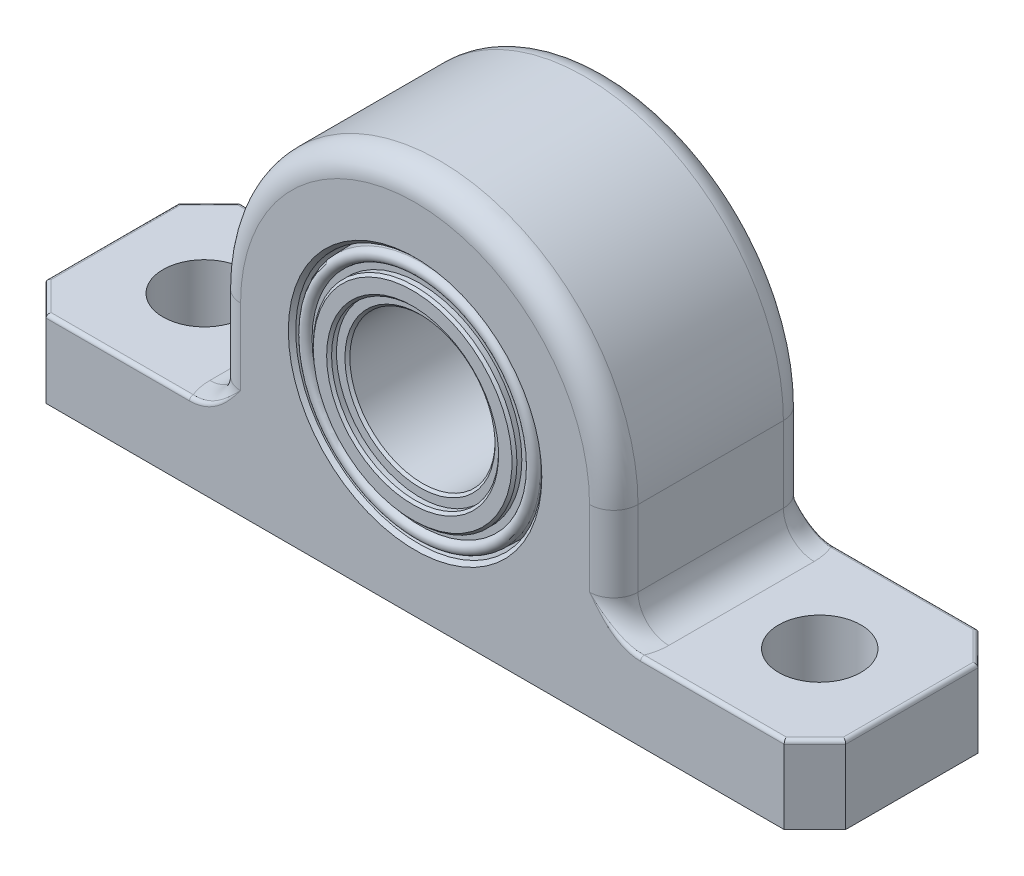
from build123d import *

# Parameters (mm, degrees)
BOSS_EXTRUDE1_DEPTH      = 10
BOSS_EXTRUDE1_DEPTH_BACK = 10
SKETCH3_R                = 12.6952
SKETCH4_R                = 4.25
CUT_EXTRUDE1_DEPTH       = 58.981139175
CHAMFER1_SIZE            = 3.175
FILLET1_R                = 2.5
FILLET2_R                = 3.175
CHAMFER2_SIZE            = 0.381
FILLET3_R                = 0.381
CHAMFER3_SIZE            = 0.254


with BuildPart() as part:
    # Sketch3 → Boss-Extrude1 (new, two sides: drawn at the far end of the back side and taken through both)
    with BuildSketch(Plane.XY.offset(-BOSS_EXTRUDE1_DEPTH_BACK)):
        with BuildLine():
            Line((-41.25, 0), (-41.25, 8))
            Line((-41.25, 8), (-20.5, 8))
            Line((-20.5, 8), (-20.5, 19))
            ThreePointArc((-20.5, 19), (0, 39.5), (20.5, 19))
            Line((20.5, 19), (20.5, 8))
            Line((20.5, 8), (41.25, 8))
            Line((41.25, 8), (41.25, 0))
            Line((41.25, 0), (-41.25, 0))
        make_face()
        with Locations((0, 19)):
            Circle(SKETCH3_R, mode=Mode.SUBTRACT)
    extrude(amount=BOSS_EXTRUDE1_DEPTH + BOSS_EXTRUDE1_DEPTH_BACK)

    # Sketch4 → Cut-Extrude1 (cut, through all)
    with BuildSketch(Plane(origin=(0, 0, 0), x_dir=(1, 0, 0), z_dir=(0, 1, 0))):
        with Locations(Location((-31.75, 0, 0), (0, 0, 270))):
            Circle(SKETCH4_R)
        with Locations(Location((31.75, 0, 0), (0, 0, 180))):
            Circle(SKETCH4_R)
    extrude(amount=CUT_EXTRUDE1_DEPTH, mode=Mode.SUBTRACT)

    # Chamfer1
    chamfer1_edges = [part.edges().sort_by_distance(p)[0] for p in [
        (41.25, 4, 10),
        (-41.25, 4, -10),
        (-41.25, 4, 10),
        (41.25, 4, -10),
    ]]
    chamfer(chamfer1_edges, length=CHAMFER1_SIZE)

    # Fillet1
    fillet1_edges = [part.edges().sort_by_distance(p)[0] for p in [
        (20.5, 13.5, -10),
        (0, 39.5, -10),
        (-20.5, 13.5, -10),
        (20.5, 13.5, 10),
        (0, 39.5, 10),
        (-20.5, 13.5, 10),
    ]]
    fillet(fillet1_edges, radius=FILLET1_R)

    # Fillet2
    # the kernel refuses this fillet: 3.175 mm, written as the material it adds along each edge
    with BuildSketch(Plane(origin=(-20.5, 8, 7.5), x_dir=(-1, 0, 0), z_dir=(0, 0, -1))) as fillet2_piece_1:
        with BuildLine():
            CenterArc((FILLET2_R, FILLET2_R), FILLET2_R, 180, 90)
            Line((0, FILLET2_R), (0, 0))
            Line((0, 0), (FILLET2_R, 0))
        make_face()
    extrude(amount=15)
    with BuildSketch(Plane(origin=(20.5, 8, 7.5), x_dir=(1, 0, 0), z_dir=(0, 0, -1))) as fillet2_piece_2:
        with BuildLine():
            CenterArc((FILLET2_R, -FILLET2_R), FILLET2_R, 90, 90)
            Line((0, -FILLET2_R), (0, 0))
            Line((0, 0), (FILLET2_R, 0))
        make_face()
    extrude(amount=15)
    with BuildSketch(Plane(origin=(-18, 8, -7.5), x_dir=(-0.03467581693539278, 0, 0.9993986130267857), z_dir=(-0.9993986130267857, 0, -0.03467581693539278))) as fillet2_piece_3_section:
        with BuildLine():
            CenterArc((-2.5 - FILLET2_R, FILLET2_R), FILLET2_R, 270, 90)
            Line((-2.5, FILLET2_R), (-2.5, 0))
            Line((-2.5, 0), (-2.5 - FILLET2_R, 0))
        make_face()
    fillet2_piece_3 = revolve(axis=Axis((-18, 8, -7.5), (0, 1, 0)), revolution_arc=271.987176332, mode=Mode.PRIVATE)
    fillet2_piece_3 = split(fillet2_piece_3, bisect_by=Plane(origin=(-19.885490697, 9.038383222, -10), z_dir=(0, 0, 1)), keep=Keep.TOP, mode=Mode.PRIVATE)
    add(fillet2_piece_3)
    with BuildSketch(Plane(origin=(-18, 8, 7.5), x_dir=(-0.03467581693539278, 0, -0.9993986130267857), z_dir=(-0.9993986130267857, 0, 0.03467581693539278))) as fillet2_piece_4_section:
        with BuildLine():
            CenterArc((-2.5 - FILLET2_R, -FILLET2_R), FILLET2_R, 0, 90)
            Line((-2.5, -FILLET2_R), (-2.5, 0))
            Line((-2.5, 0), (-2.5 - FILLET2_R, 0))
        make_face()
    fillet2_piece_4 = revolve(axis=Axis((-18, 8, 7.5), (0, -1, 0)), revolution_arc=271.987176332, mode=Mode.PRIVATE)
    fillet2_piece_4 = split(fillet2_piece_4, bisect_by=Plane(origin=(-19.885490697, 9.038383222, 10), z_dir=(0, 0, -1)), keep=Keep.TOP, mode=Mode.PRIVATE)
    add(fillet2_piece_4)
    with BuildSketch(Plane(origin=(18, 8, -7.5), x_dir=(0.034675816935389944, 0, 0.9993986130267859), z_dir=(0.9993986130267859, 0, -0.034675816935389944))) as fillet2_piece_5_section:
        with BuildLine():
            CenterArc((-2.5 - FILLET2_R, -FILLET2_R), FILLET2_R, 0, 90)
            Line((-2.5, -FILLET2_R), (-2.5, 0))
            Line((-2.5, 0), (-2.5 - FILLET2_R, 0))
        make_face()
    fillet2_piece_5 = revolve(axis=Axis((18, 8, -7.5), (0, -1, 0)), revolution_arc=271.987176332, mode=Mode.PRIVATE)
    fillet2_piece_5 = split(fillet2_piece_5, bisect_by=Plane(origin=(19.885490637, 9.038383433, -10), z_dir=(0, 0, 1)), keep=Keep.TOP, mode=Mode.PRIVATE)
    add(fillet2_piece_5)
    with BuildSketch(Plane(origin=(18, 8, 7.5), x_dir=(0.034675816935389944, 0, -0.9993986130267859), z_dir=(0.9993986130267859, 0, 0.034675816935389944))) as fillet2_piece_6_section:
        with BuildLine():
            CenterArc((-2.5 - FILLET2_R, FILLET2_R), FILLET2_R, 270, 90)
            Line((-2.5, FILLET2_R), (-2.5, 0))
            Line((-2.5, 0), (-2.5 - FILLET2_R, 0))
        make_face()
    fillet2_piece_6 = revolve(axis=Axis((18, 8, 7.5), (0, 1, 0)), revolution_arc=271.987176332, mode=Mode.PRIVATE)
    fillet2_piece_6 = split(fillet2_piece_6, bisect_by=Plane(origin=(19.885490637, 9.038383433, 10), z_dir=(0, 0, -1)), keep=Keep.TOP, mode=Mode.PRIVATE)
    add(fillet2_piece_6)

    # Chamfer2
    chamfer2_edges = [part.edges().sort_by_distance(p)[0] for p in [
        (-12.6952, 19, -10),
        (-12.6952, 19, 10),
    ]]
    chamfer(chamfer2_edges, length=CHAMFER2_SIZE)

    # Fillet3
    fillet3_edges = [part.edges().sort_by_distance(p)[0] for p in [
        (-30.584833164, 8, -10),
        (-30.584833164, 8, 10),
        (-20.219976999, 9.019948151, -10),
        (-20.219976999, 9.019948151, 10),
        (20.219976999, 9.019948151, -10),
        (20.219976999, 9.019948151, 10),
        (-41.25, 8, 0),
        (30.584833164, 8, -10),
        (-39.6625, 8, 8.4125),
        (-39.6625, 8, -8.4125),
        (30.584833164, 8, 10),
        (41.25, 8, 0),
        (39.6625, 8, -8.4125),
        (39.6625, 8, 8.4125),
    ]]
    fillet(fillet3_edges, radius=FILLET3_R)


with BuildPart() as body_2:
    # Sketch6 → Revolve1 (revolve)
    with BuildSketch(Plane(origin=(0, 0, 0), x_dir=(0, 0, -1), z_dir=(1, 0, 0)), mode=Mode.PRIVATE) as revolve1_sk:
        with BuildLine():
            Line((0, 31.6952), (10, 31.6952))
            Line((10, 31.6952), (10, 30.137048122))
            Line((10, 30.137048122), (6.19, 30.137048122))
            Line((6.19, 30.137048122), (6.19, 29.507872727))
            Line((6.19, 29.507872727), (8.73, 29.507872727))
            Line((8.73, 29.507872727), (8.73, 27.6158))
            Line((8.73, 27.6158), (7.968, 27.6158))
            Line((7.968, 27.6158), (7.968, 26.492))
            Line((7.968, 26.492), (-9.492, 26.492))
            Line((-9.492, 26.492), (-9.492, 27.6158))
            Line((-9.492, 27.6158), (-10.254, 27.6158))
            Line((-10.254, 27.6158), (-10.254, 29.507872727))
            Line((-10.254, 29.507872727), (-9.492, 29.507872727))
            Line((-9.492, 29.507872727), (-9.492, 30.137048122))
            ThreePointArc((-9.492, 30.137048122), (-9.998324352, 30.792601929), (-9.40141384, 31.366895394))
            Line((-9.40141384, 31.366895394), (0, 31.6952))
        make_face()
    revolve(revolve1_sk.sketch.rotate(Axis((0, 19, 10), (0, 0, -1)), 90), axis=Axis((0, 19, 10), (0, 0, -1)))

    # Chamfer3
    chamfer3_edges = [body_2.edges().sort_by_distance(p)[0] for p in [
        (-10.507872727, 19, -8.73),
        (-8.6158, 19, -8.73),
        (-7.492, 19, -7.968),
        (-7.492, 19, 9.492),
        (-8.6158, 19, 10.254),
        (-10.507872727, 19, 10.254),
    ]]
    chamfer(chamfer3_edges, length=CHAMFER3_SIZE)


solid = Compound([part.part, body_2.part])
